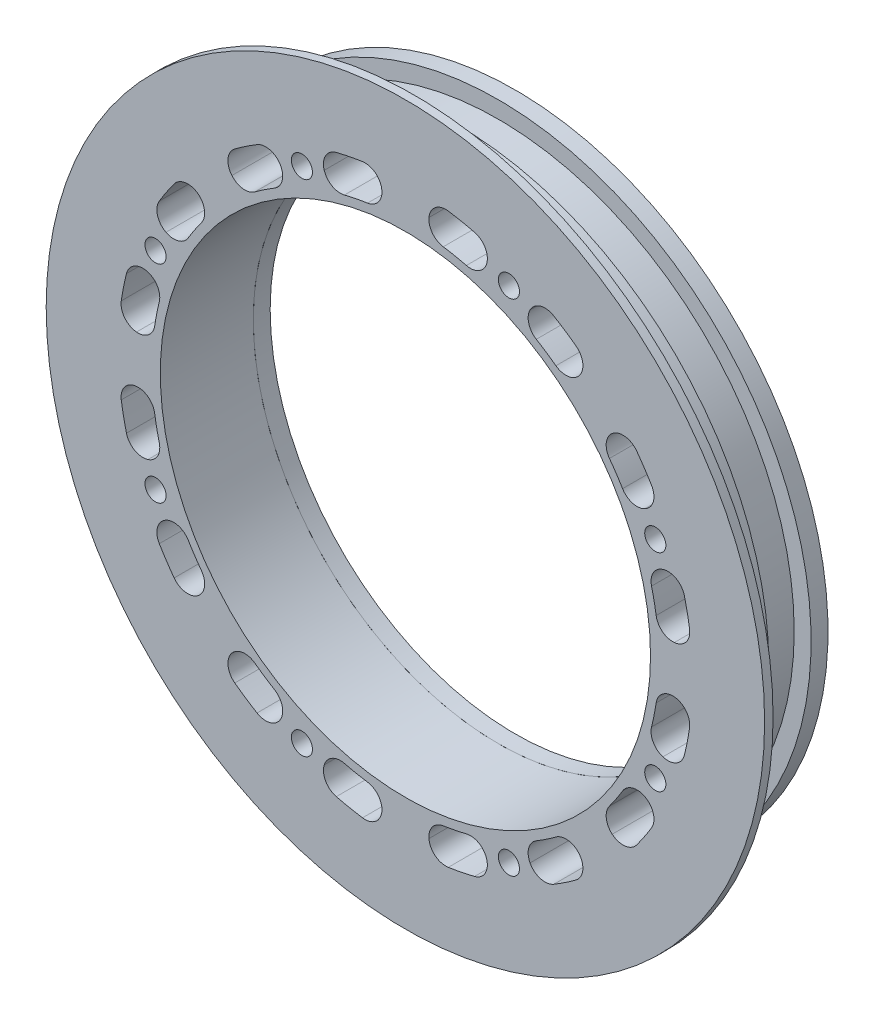
from build123d import *

# Parameters (mm, degrees)
SKETCH_1_R               = 35
EXTRUDE_1_DEPTH          = 5
SKETCH_2_R               = 37
EXTRUDE_2_DEPTH          = 2
SKETCH_3_R               = 37
EXTRUDE_3_DEPTH          = 2
SKETCH_4_R               = 29
CUT_EXTRUDE_1_DEPTH      = 20
SKETCH_5_R               = 2
CUT_EXTRUDE_2_DEPTH      = 2
SKETCH_6_R               = 1.65
CUT_EXTRUDE_3_DEPTH      = 8
SKETCH_7_R               = 37
SKETCH_7_R_2             = 29
EXTRUDE_4_DEPTH          = 4
SKETCH_8_R               = 1.25
CUT_EXTRUDE_4_DEPTH      = 20
CUT_EXTRUDE_5_DEPTH      = 2
PATTERN_CIRCULAR_1_COUNT = 8
FILLET_1_R               = 1.5
CUT_EXTRUDE_START        = -11
CUT_EXTRUDE_6_DEPTH      = 11
PATTERN_CIRCULAR_2_COUNT = 16
FILLET_2_R               = 2
EXTRUDE_START            = -1
SKETCH_11_R              = 42.5
SKETCH_11_R_2            = 37
EXTRUDE_5_DEPTH          = 1


with BuildPart() as part:
    # 草图1 → 凸台-拉伸1 (new body)
    with BuildSketch(Plane.XY):
        Circle(SKETCH_1_R)
    extrude(amount=EXTRUDE_1_DEPTH)

    # 草图2 → 凸台-拉伸2 (add)
    with BuildSketch(Plane.XY.offset(5)):
        Circle(SKETCH_2_R)
    extrude(amount=EXTRUDE_2_DEPTH)


with BuildPart() as body_2:
    # 草图3 → 凸台-拉伸3 (new body)
    with BuildSketch(Plane(origin=(0, 0, 0), x_dir=(-1, 0, 0), z_dir=(0, 0, -1))):
        Circle(SKETCH_3_R)
    extrude(amount=EXTRUDE_3_DEPTH)


with BuildPart() as cut_extrude_1_tool:
    # 草图4 → 切除-拉伸1 (new body)
    with BuildSketch(Plane.XY.offset(7)):
        with Locations(Location((0, 0, 0), (0, 0, 180))):
            Circle(SKETCH_4_R)
    extrude(amount=-CUT_EXTRUDE_1_DEPTH)


with BuildPart() as part_1:
    add(part.part)

    # 切除-拉伸1: cut by cut_extrude_1_tool
    add(cut_extrude_1_tool.part, mode=Mode.SUBTRACT)

    # 草图6 → 切除-拉伸3 (cut)
    with BuildSketch(Plane(origin=(0, 0, 0), x_dir=(-1, 0, 0), z_dir=(0, 0, -1))):
        with Locations((0, 32.5)):
            Circle(SKETCH_6_R)
        with Locations((22.980970389, 22.980970389)):
            Circle(SKETCH_6_R)
        with Locations((32.5, 0)):
            Circle(SKETCH_6_R)
        with Locations((22.980970389, -22.980970389)):
            Circle(SKETCH_6_R)
        with Locations((0, -32.5)):
            Circle(SKETCH_6_R)
        with Locations((-22.980970389, -22.980970389)):
            Circle(SKETCH_6_R)
        with Locations((-32.5, 0)):
            Circle(SKETCH_6_R)
        with Locations((-22.980970389, 22.980970389)):
            Circle(SKETCH_6_R)
    extrude(amount=-CUT_EXTRUDE_3_DEPTH, mode=Mode.SUBTRACT)

    # 草图7 → 凸台-拉伸4 (add)
    with BuildSketch(Plane.XY.offset(7)):
        with Locations(Location((0, 0, 0), (0, 0, 180))):
            Circle(SKETCH_7_R)
        with Locations(Location((0, 0, 0), (0, 0, 180))):
            Circle(SKETCH_7_R_2, mode=Mode.SUBTRACT)
    extrude(amount=EXTRUDE_4_DEPTH)

    # 草图8 → 切除-拉伸4 (cut)
    with BuildSketch(Plane.XY.offset(11)):
        with Locations((12.245869836, 29.56414504)):
            Circle(SKETCH_8_R)
        with Locations((29.56414504, 12.245869836)):
            Circle(SKETCH_8_R)
        with Locations((29.56414504, -12.245869836)):
            Circle(SKETCH_8_R)
        with Locations((12.245869836, -29.56414504)):
            Circle(SKETCH_8_R)
        with Locations((-12.245869836, -29.56414504)):
            Circle(SKETCH_8_R)
        with Locations((-29.56414504, -12.245869836)):
            Circle(SKETCH_8_R)
        with Locations((-29.56414504, 12.245869836)):
            Circle(SKETCH_8_R)
        with Locations((-12.245869836, 29.56414504)):
            Circle(SKETCH_8_R)
    extrude(amount=-CUT_EXTRUDE_4_DEPTH, mode=Mode.SUBTRACT)

    # 草图10 → 切除-拉伸6 (cut)
    with BuildSketch(Plane(origin=(0, 0, 0), x_dir=(-1, 0, 0), z_dir=(0, 0, -1)).offset(CUT_EXTRUDE_START)):
        with BuildLine():
            ThreePointArc((10.223997183, 32.426376325), (6.633070949, 33.346699534), (2.963295253, 33.870619735))
            Line((2.963295253, 33.870619735), (2.614672282, 29.885840943))
            ThreePointArc((2.614672282, 29.885840943), (5.85270966, 29.423558412), (9.021173985, 28.611508522))
            Line((9.021173985, 28.611508522), (10.223997183, 32.426376325))
        make_face()
    cut_extrude_6 = extrude(amount=CUT_EXTRUDE_6_DEPTH, mode=Mode.SUBTRACT)

    # 阵列(圆周)2: 切除-拉伸6 ×16 about axis
    pattern_circular_2_axis = Axis((0, 0, 0), (0, 0, 1))
    for i in range(1, PATTERN_CIRCULAR_2_COUNT):
        add(cut_extrude_6.rotate(pattern_circular_2_axis, i * 360 / PATTERN_CIRCULAR_2_COUNT), mode=Mode.SUBTRACT)

    # 圆角2
    fillet_2_edges = [part_1.edges().sort_by_distance(p)[0] for p in [
        (-10.223997183, 32.426376325, 5.5),
        (-9.021173985, 28.611508522, 5.5),
        (-2.963295253, 33.870619735, 5.5),
        (-2.614672282, 29.885840943, 5.5),
        (-21.854778729, 26.045511066, 5.5),
        (-19.283628291, 22.981333294, 5.5),
        (-15.69945285, 30.158368328, 5.5),
        (2.963295253, 33.870619735, 5.5),
        (2.614672282, 29.885840943, 5.5),
        (9.021173985, 28.611508522, 5.5),
        (10.223997183, 32.426376325, 5.5),
        (15.69945285, 30.158368328, 5.5),
        (13.852458397, 26.610324995, 5.5),
        (19.283628291, 22.981333294, 5.5),
        (21.854778729, 26.045511066, 5.5),
        (26.045511066, 21.854778729, 5.5),
        (22.981333294, 19.283628291, 5.5),
        (26.610324995, 13.852458397, 5.5),
        (30.158368328, 15.69945285, 5.5),
        (32.426376325, 10.223997183, 5.5),
        (28.611508522, 9.021173985, 5.5),
        (29.885840943, 2.614672282, 5.5),
        (33.870619735, 2.963295253, 5.5),
        (33.870619735, -2.963295253, 5.5),
        (29.885840943, -2.614672282, 5.5),
        (28.611508522, -9.021173985, 5.5),
        (32.426376325, -10.223997183, 5.5),
        (30.158368328, -15.69945285, 5.5),
        (26.610324995, -13.852458397, 5.5),
        (22.981333294, -19.283628291, 5.5),
        (26.045511066, -21.854778729, 5.5),
        (21.854778729, -26.045511066, 5.5),
        (19.283628291, -22.981333294, 5.5),
        (13.852458397, -26.610324995, 5.5),
        (15.69945285, -30.158368328, 5.5),
        (10.223997183, -32.426376325, 5.5),
        (9.021173985, -28.611508522, 5.5),
        (2.614672282, -29.885840943, 5.5),
        (2.963295253, -33.870619735, 5.5),
        (-2.963295253, -33.870619735, 5.5),
        (-2.614672282, -29.885840943, 5.5),
        (-9.021173985, -28.611508522, 5.5),
        (-10.223997183, -32.426376325, 5.5),
        (-15.69945285, -30.158368328, 5.5),
        (-13.852458397, -26.610324995, 5.5),
        (-19.283628291, -22.981333294, 5.5),
        (-21.854778729, -26.045511066, 5.5),
        (-26.045511066, -21.854778729, 5.5),
        (-22.981333294, -19.283628291, 5.5),
        (-26.610324995, -13.852458397, 5.5),
        (-30.158368328, -15.69945285, 5.5),
        (-32.426376325, -10.223997183, 5.5),
        (-28.611508522, -9.021173985, 5.5),
        (-29.885840943, -2.614672282, 5.5),
        (-33.870619735, -2.963295253, 5.5),
        (-33.870619735, 2.963295253, 5.5),
        (-29.885840943, 2.614672282, 5.5),
        (-28.611508522, 9.021173985, 5.5),
        (-32.426376325, 10.223997183, 5.5),
        (-30.158368328, 15.69945285, 5.5),
        (-26.610324995, 13.852458397, 5.5),
        (-22.981333294, 19.283628291, 5.5),
        (-26.045511066, 21.854778729, 5.5),
        (-13.852458397, 26.610324995, 5.5),
    ]]
    fillet(fillet_2_edges, radius=FILLET_2_R - 0.0001)  # a hair under: the kernel refuses the full size

    # 草图11 → 凸台-拉伸5 (add)
    with BuildSketch(Plane.XY.offset(11).offset(EXTRUDE_START)):
        Circle(SKETCH_11_R)
        with Locations(Location((0, 0, 0), (0, 0, 180))):
            Circle(SKETCH_11_R_2, mode=Mode.SUBTRACT)
    extrude(amount=EXTRUDE_5_DEPTH)


with BuildPart() as body_2_1:
    add(body_2.part)

    # 切除-拉伸1: cut by cut_extrude_1_tool
    add(cut_extrude_1_tool.part, mode=Mode.SUBTRACT)

    # 草图5 → 切除-拉伸2 (cut)
    with BuildSketch(Plane(origin=(0, 0, -2), x_dir=(-1, 0, 0), z_dir=(0, 0, -1))):
        with Locations((0, 32.5)):
            Circle(SKETCH_5_R)
        with Locations((22.980970389, 22.980970389)):
            Circle(SKETCH_5_R)
        with Locations((32.5, 0)):
            Circle(SKETCH_5_R)
        with Locations((22.980970389, -22.980970389)):
            Circle(SKETCH_5_R)
        with Locations((0, -32.5)):
            Circle(SKETCH_5_R)
        with Locations((-22.980970389, -22.980970389)):
            Circle(SKETCH_5_R)
        with Locations((-32.5, 0)):
            Circle(SKETCH_5_R)
        with Locations((-22.980970389, 22.980970389)):
            Circle(SKETCH_5_R)
    extrude(amount=-CUT_EXTRUDE_2_DEPTH, mode=Mode.SUBTRACT)

    # 草图9 → 切除-拉伸5 (cut)
    with BuildSketch(Plane(origin=(0, 0, -2), x_dir=(-1, 0, 0), z_dir=(0, 0, -1))):
        with BuildLine():
            ThreePointArc((21.002269301, 27.37069024), (13.202578417, 31.873843872), (4.503153632, 34.204847717))
            Line((4.503153632, 34.204847717), (4.111575055, 31.230513133))
            ThreePointArc((4.111575055, 31.230513133), (12.054528119, 29.102205274), (19.175985014, 24.990630219))
            Line((19.175985014, 24.990630219), (21.002269301, 27.37069024))
        make_face()
    cut_extrude_5 = extrude(amount=-CUT_EXTRUDE_5_DEPTH, mode=Mode.SUBTRACT)

    # 阵列(圆周)1: 切除-拉伸5 ×8 about axis
    pattern_circular_1_axis = Axis((0, 0, 0), (0, 0, 1))
    for i in range(1, PATTERN_CIRCULAR_1_COUNT):
        add(cut_extrude_5.rotate(pattern_circular_1_axis, i * 360 / PATTERN_CIRCULAR_1_COUNT), mode=Mode.SUBTRACT)

    # 圆角1
    fillet_1_edges = [body_2_1.edges().sort_by_distance(p)[0] for p in [
        (-4.111575055, 31.230513133, -1),
        (-4.503153632, 34.204847717, -1),
        (-21.002269301, 27.37069024, -1),
        (-19.175985014, 24.990630219, -1),
        (-24.990630219, 19.175985014, -1),
        (-27.37069024, 21.002269301, -1),
        (-34.204847717, 4.503153632, -1),
        (-31.230513133, 4.111575055, -1),
        (-31.230513133, -4.111575055, -1),
        (-34.204847717, -4.503153632, -1),
        (-27.37069024, -21.002269301, -1),
        (-24.990630219, -19.175985014, -1),
        (-19.175985014, -24.990630219, -1),
        (-21.002269301, -27.37069024, -1),
        (-4.503153632, -34.204847717, -1),
        (-4.111575055, -31.230513133, -1),
        (4.111575055, -31.230513133, -1),
        (4.503153632, -34.204847717, -1),
        (21.002269301, -27.37069024, -1),
        (19.175985014, -24.990630219, -1),
        (24.990630219, -19.175985014, -1),
        (27.37069024, -21.002269301, -1),
        (34.204847717, -4.503153632, -1),
        (31.230513133, -4.111575055, -1),
        (31.230513133, 4.111575055, -1),
        (34.204847717, 4.503153632, -1),
        (27.37069024, 21.002269301, -1),
        (24.990630219, 19.175985014, -1),
        (21.002269301, 27.37069024, -1),
        (4.503153632, 34.204847717, -1),
        (4.111575055, 31.230513133, -1),
        (19.175985014, 24.990630219, -1),
    ]]
    fillet(fillet_1_edges, radius=FILLET_1_R - 0.0001)  # a hair under: the kernel refuses the full size


solid = Compound([part_1.part, body_2_1.part])
